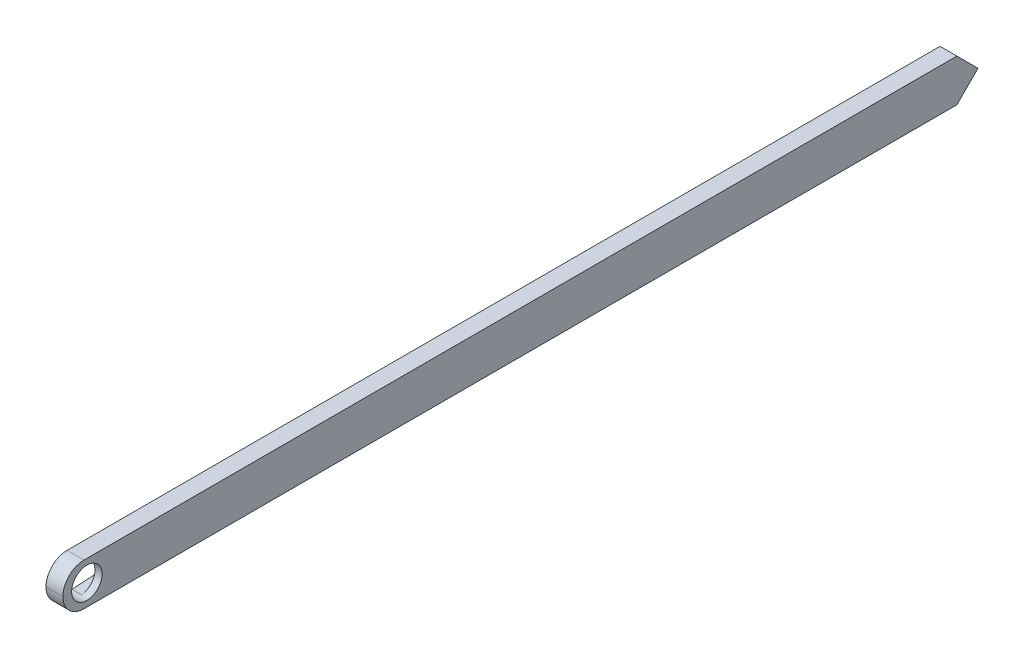
from build123d import *

# Parameters (mm, degrees)
SKETCH1_W           = 191.86
SKETCH1_H           = 10
BOSS_EXTRUDE1_DEPTH = 4
SKETCH7_R           = 3.61
CUT_EXTRUDE1_DEPTH  = 218.127288934
CUT_EXTRUDE2_DEPTH  = 2.3
FILLET1_R           = 5
FILLET2_R           = 2


# Some blends are built 0.0001 mm under size
with BuildPart() as part:
    # Sketch1 → Boss-Extrude1 (new body)
    with BuildSketch(Plane(origin=(0, 0, 0), x_dir=(0, 0, -1), z_dir=(1, 0, 0))):
        with Locations((95.93, 5)):
            Rectangle(SKETCH1_W, SKETCH1_H)
        Polygon((211.86, 0), (191.86, 0), (191.86, 10), (211.86, 10), (216.86, 5), align=None)
    extrude(amount=BOSS_EXTRUDE1_DEPTH)

    # Sketch7 → Cut-Extrude1 (cut, through all)
    with BuildSketch(Plane.ZY):
        with Locations((-5.6896, 5)):
            Circle(SKETCH7_R)
    extrude(amount=-CUT_EXTRUDE1_DEPTH, mode=Mode.SUBTRACT)

    # Sketch7<3> → Cut-Extrude2 (cut)
    with BuildSketch(Plane.ZY):
        with BuildLine():
            ThreePointArc((-6.154035141, 1.42), (-9.2996, 5), (-6.154035141, 8.58))
            Line((-6.154035141, 8.58), (-23.227363545, 7.505))
            ThreePointArc((-23.227363545, 7.505), (-25.5796, 5), (-23.227363545, 2.495))
            Line((-23.227363545, 2.495), (-6.154035141, 1.42))
        make_face()
    extrude(amount=-CUT_EXTRUDE2_DEPTH, mode=Mode.SUBTRACT)

    # Fillet1
    fillet1_edges = [part.edges().sort_by_distance(p)[0] for p in [
        (2, 10, 0),
        (2, 0, 0),
    ]]
    fillet(fillet1_edges, radius=FILLET1_R - 0.0001)  # a hair under: the kernel refuses the full size

    # Fillet2
    # the kernel refuses this fillet: 2 mm, written as the material it takes off along each edge
    with BuildSketch(Plane(origin=(-0.147213915, 1.42, -6.154035141), x_dir=(0, -0.12216150848858905, 0.9925102346292417), z_dir=(1, 0, 0))) as fillet2_piece_1:
        with BuildLine():
            CenterArc((0.060321863, 1.999957195), FILLET2_R, 266.585932682, 3.039206924)
            Line((-0.058781058, 0.003506721), (0, 0))
            ThreePointArc((0, 0), (0.02361843, 7.7263e-05), (0.04723686, 0))
        make_face()
    extrude(amount=2.447213915, mode=Mode.SUBTRACT)
    with BuildSketch(Plane(origin=(-0.147213915, 8.58, -6.154035141), x_dir=(0, 0.12216150848853974, 0.9925102346292478), z_dir=(1, 0, 0))) as fillet2_piece_2:
        with BuildLine():
            CenterArc((0.060321863, -1.999957195), FILLET2_R, 90.374860394, 3.039206924)
            Line((-0.058781058, -0.003506721), (0, 0))
            ThreePointArc((0, 0), (0.02361843, -7.7263e-05), (0.04723686, 0))
        make_face()
    extrude(amount=2.447213915, mode=Mode.SUBTRACT)


solid = part.part
